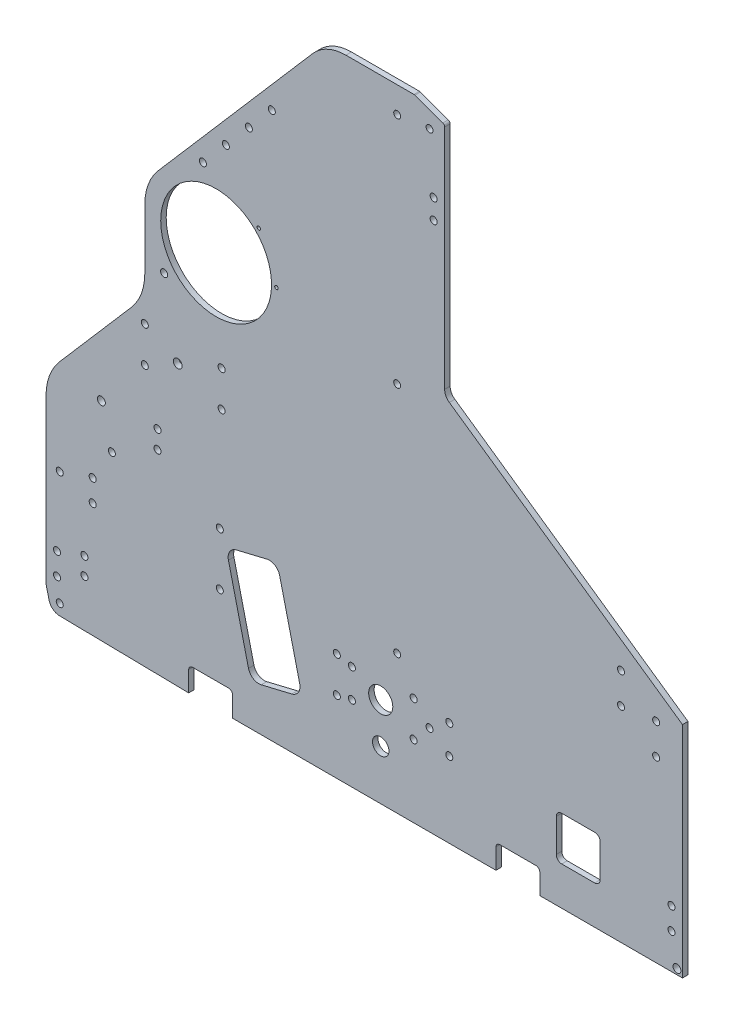
from build123d import *

# Parameters (mm, degrees)
SKETCH1_R           = 2.032
SKETCH1_R_2         = 2.54
SKETCH1_R_3         = 2
BOSS_EXTRUDE1_DEPTH = 3.175
FILLET1_R           = 2.286
FILLET2_R           = 6.35
SKETCH2_R           = 2.032
CUT_EXTRUDE1_DEPTH  = 505.524983177
FILLET3_R           = 1.5875
SKETCH3_R           = 2.032
SKETCH3_R_2         = 2.286
SKETCH3_R_3         = 1.016
CUT_EXTRUDE2_DEPTH  = 505.524983177
SKETCH4_R           = 2.032
SKETCH4_R_2         = 6.985
SKETCH4_R_3         = 4.7625
CUT_EXTRUDE3_DEPTH  = 505.524983177
SKETCH5_R           = 32.0675
SKETCH5_R_2         = 2.286
CUT_EXTRUDE5_DEPTH  = 540.282512218
FILLET4_R           = 31.75
CUT_EXTRUDE6_DEPTH  = 505.524983177
SKETCH7_R           = 2.031999999
SKETCH7_R_2         = 2.032
CUT_EXTRUDE7_DEPTH  = 2.54
FILLET5_R           = 25.4


with BuildPart() as part:
    # Sketch1 → Boss-Extrude1 (new body)
    with BuildSketch(Plane.XY):
        with BuildLine():
            Line((7.829508682, -19.049081656), (82.55, -20.32))
            Line((82.55, -20.32), (82.55, -6.35))
            Line((82.55, -6.35), (107.95, -6.35))
            Line((107.95, -6.35), (107.95, -20.32))
            Line((107.95, -20.32), (260.35, -20.32))
            Line((260.35, -20.32), (260.35, -6.35))
            Line((260.35, -6.35), (285.75, -6.35))
            Line((285.75, -6.35), (285.75, -20.32))
            Line((285.75, -20.32), (368.3, -20.32))
            Line((368.3, -20.32), (368.3, 106.68))
            Line((368.3, 106.68), (230.66375, 202.565))
            Line((230.66375, 202.565), (230.66375, 338.455))
            Line((230.66375, 338.455), (213.19998, 344.805))
            Line((213.19998, 344.805), (203.2, 344.805))
            Line((203.2, 344.805), (161.925, 344.805))
            Line((161.925, 344.805), (52.720122664, 218.469945827))
            ThreePointArc((52.720122664, 218.469945827), (52.803835479, 218.142145922), (52.832, 217.805))
            ThreePointArc((52.832, 217.805), (52.095493096, 216.239521914), (50.419872403, 215.808871996))
            Line((50.419872403, 215.808871996), (0, 157.48))
            Line((0, 157.48), (0, 0))
            Line((0, 0), (0, -6.35))
            ThreePointArc((0, -6.35), (0.047577015, -7.125863724), (0.189595124, -7.890101219))
            Line((0.189595124, -7.890101219), (1.777095124, -14.240101219))
            ThreePointArc((1.777095124, -14.240101219), (3.987212552, -17.671692778), (7.829508682, -19.049081656))
        make_face()
        with Locations((7.9375, -12.7)):
            Circle(SKETCH1_R, mode=Mode.SUBTRACT)
        with Locations((6.35, 0)):
            Circle(SKETCH1_R, mode=Mode.SUBTRACT)
        with Locations((6.35, 12.7)):
            Circle(SKETCH1_R, mode=Mode.SUBTRACT)
        with Locations((38.1, 78.105)):
            Circle(SKETCH1_R, mode=Mode.SUBTRACT)
        with Locations((57.15, 131.28625)):
            Circle(SKETCH1_R, mode=Mode.SUBTRACT)
        with Locations((57.15, 151.92375)):
            Circle(SKETCH1_R, mode=Mode.SUBTRACT)
        with Locations((76.2, 141.605)):
            Circle(SKETCH1_R_2, mode=Mode.SUBTRACT)
        with Locations((101.6, 131.28625)):
            Circle(SKETCH1_R, mode=Mode.SUBTRACT)
        with Locations((101.6, 151.92375)):
            Circle(SKETCH1_R, mode=Mode.SUBTRACT)
        with Locations((203.2, 59.805)):
            Circle(SKETCH1_R_3, mode=Mode.SUBTRACT)
        with Locations((361.95, 0)):
            Circle(SKETCH1_R, mode=Mode.SUBTRACT)
        with Locations((361.95, 12.7)):
            Circle(SKETCH1_R, mode=Mode.SUBTRACT)
        with Locations((353.06, 82.955052336)):
            Circle(SKETCH1_R, mode=Mode.SUBTRACT)
        with Locations((332.74, 98.195052336)):
            Circle(SKETCH1_R, mode=Mode.SUBTRACT)
        with Locations((332.74, 115.975052336)):
            Circle(SKETCH1_R, mode=Mode.SUBTRACT)
        with Locations((353.06, 100.735052336)):
            Circle(SKETCH1_R, mode=Mode.SUBTRACT)
        with Locations((68.326, 182.923674932)):
            Circle(SKETCH1_R, mode=Mode.SUBTRACT)
        with Locations((76.2, 217.805)):
            Circle(SKETCH1_R, mode=Mode.SUBTRACT)
        with Locations((90.779500502, 249.682)):
            Circle(SKETCH1_R, mode=Mode.SUBTRACT)
        with Locations((104.067838673, 265.054783374)):
            Circle(SKETCH1_R, mode=Mode.SUBTRACT)
        with Locations((117.356176844, 280.427566748)):
            Circle(SKETCH1_R, mode=Mode.SUBTRACT)
        with Locations((130.644515014, 295.800350122)):
            Circle(SKETCH1_R, mode=Mode.SUBTRACT)
        with Locations((203.2, 194.805)):
            Circle(SKETCH1_R_3, mode=Mode.SUBTRACT)
        with Locations((224.31375, 287.401)):
            Circle(SKETCH1_R, mode=Mode.SUBTRACT)
        with Locations((224.31375, 298.831)):
            Circle(SKETCH1_R, mode=Mode.SUBTRACT)
        with Locations((203.2, 329.805)):
            Circle(SKETCH1_R_3, mode=Mode.SUBTRACT)
        with Locations((221.931865, 332.105)):
            Circle(SKETCH1_R_3, mode=Mode.SUBTRACT)
    extrude(amount=BOSS_EXTRUDE1_DEPTH)

    # Fillet1
    fillet1_edges = [part.edges().sort_by_distance(p)[0] for p in [
        (285.75, -6.35, 1.5875),
        (107.95, -6.35, 1.5875),
        (260.35, -6.35, 1.5875),
        (82.55, -6.35, 1.5875),
    ]]
    fillet(fillet1_edges, radius=FILLET1_R)

    # Fillet2
    fillet2_edges = [part.edges().sort_by_distance(p)[0] for p in [
        (230.66375, 202.565, 1.5875),
    ]]
    fillet(fillet2_edges, radius=FILLET2_R)

    # Sketch2 → Cut-Extrude1 (cut, through all)
    with BuildSketch(Plane(origin=(0, 0, 0), x_dir=(-1, 0, 0), z_dir=(0, 0, -1))):
        with Locations((-100.552770272, 71.086035298)):
            Circle(SKETCH2_R)
        with Locations((-100.552770272, 40.606035298)):
            Circle(SKETCH2_R)
        with Locations((-22.225, 18.202541089)):
            Circle(SKETCH2_R)
        with Locations((-22.225, 8.042541089)):
            Circle(SKETCH2_R)
    extrude(amount=-CUT_EXTRUDE1_DEPTH, mode=Mode.SUBTRACT)

    # Fillet3
    fillet3_edges = [part.edges().sort_by_distance(p)[0] for p in [
        (230.66375, 338.455, 1.5875),
        (213.19998, 344.805, 1.5875),
    ]]
    fillet(fillet3_edges, radius=FILLET3_R)

    # Sketch3 → Cut-Extrude2 (cut, through all)
    with BuildSketch(Plane.XY.offset(3.175)):
        with BuildLine():
            Line((127.789350211, 69.359774106), (110.090750339, 65.117184968))
            ThreePointArc((110.090750339, 65.117184968), (106.287939856, 62.356288953), (105.55119507, 57.715047577))
            Line((105.55119507, 57.715047577), (117.160037875, 9.287010566))
            ThreePointArc((117.160037875, 9.287010566), (119.92093389, 5.484200083), (124.562175266, 4.747455297))
            Line((124.562175266, 4.747455297), (142.260775137, 8.990044434))
            ThreePointArc((142.260775137, 8.990044434), (146.063585621, 11.75094045), (146.800330407, 16.392181825))
            Line((146.800330407, 16.392181825), (135.191487602, 64.820218836))
            ThreePointArc((135.191487602, 64.820218836), (132.430591586, 68.62302932), (127.789350211, 69.359774106))
        make_face()
        with Locations((26.987500002, 46.953113935)):
            Circle(SKETCH3_R)
        with Locations((26.987500002, 59.653113935)):
            Circle(SKETCH3_R)
        with Locations((7.937500002, 53.303113935)):
            Circle(SKETCH3_R)
        with Locations((32.030600738, 100.810868776)):
            Circle(SKETCH3_R_2)
        with Locations((64.525942114, 102.94048958)):
            Circle(SKETCH3_R)
        with Locations((64.525942114, 92.525786339)):
            Circle(SKETCH3_R)
        with Locations((133.35, 208.228121768)):
            Circle(SKETCH3_R_3)
        with Locations((123.120704333, 232.923826101)):
            Circle(SKETCH3_R_3)
    extrude(amount=-CUT_EXTRUDE2_DEPTH, mode=Mode.SUBTRACT)

    # Sketch4 → Cut-Extrude3 (cut, through all)
    with BuildSketch(Plane.XY.offset(3.175)):
        with Locations((168.275, 42.06875)):
            Circle(SKETCH4_R)
        with Locations((212.725, 42.06875)):
            Circle(SKETCH4_R)
        with Locations((212.725, 21.43125)):
            Circle(SKETCH4_R)
        with Locations((168.275, 21.43125)):
            Circle(SKETCH4_R)
        with Locations((193.675, 31.75)):
            Circle(SKETCH4_R_2)
        with Locations((177.00498, 40.0431)):
            Circle(SKETCH4_R)
        with Locations((177.00498, 23.4569)):
            Circle(SKETCH4_R)
        with Locations((193.675, 8.466666658)):
            Circle(SKETCH4_R_3)
        with Locations((221.931865, 31.75)):
            Circle(SKETCH4_R)
        with Locations((233.36123, 23.4569)):
            Circle(SKETCH4_R)
        with Locations((233.36123, 40.0431)):
            Circle(SKETCH4_R)
    extrude(amount=-CUT_EXTRUDE3_DEPTH, mode=Mode.SUBTRACT)

    # Sketch5 → Cut-Extrude5 (cut, through all)
    with BuildSketch(Plane(origin=(0, 0, -187.324999893), x_dir=(-1, 0, 0), z_dir=(0, 0, -1))):
        Polygon((0, 157.48), (-57.15, 223.594705882), (-57.15, 165.333696112), (0, 99.218990229), align=None)
        with Locations((-98.425, 208.228121768)):
            Circle(SKETCH5_R)
        with Locations((-365.124993903, -17.144956474)):
            Circle(SKETCH5_R_2)
    extrude(amount=-CUT_EXTRUDE5_DEPTH, mode=Mode.SUBTRACT)

    # Fillet4
    fillet4_edges = [part.edges().sort_by_distance(p)[0] for p in [
        (0, 99.218990229, 1.5875),
        (57.15, 165.333696112, 1.5875),
        (57.15, 223.594705882, 1.5875),
    ]]
    fillet(fillet4_edges, radius=FILLET4_R)

    # Sketch6 → Cut-Extrude6 (cut, through all)
    with BuildSketch(Plane.XY.offset(3.175)):
        with BuildLine():
            Line((298.45, 27.305), (317.5, 27.305))
            ThreePointArc((317.5, 27.305), (319.74506403, 26.37506403), (320.675, 24.13))
            Line((320.675, 24.13), (320.675, 5.08))
            ThreePointArc((320.675, 5.08), (319.74506403, 2.83493597), (317.5, 1.905))
            Line((317.5, 1.905), (298.45, 1.905))
            ThreePointArc((298.45, 1.905), (296.20493597, 2.83493597), (295.275, 5.08))
            Line((295.275, 5.08), (295.275, 24.13))
            ThreePointArc((295.275, 24.13), (296.20493597, 26.37506403), (298.45, 27.305))
        make_face()
    extrude(amount=-CUT_EXTRUDE6_DEPTH, mode=Mode.SUBTRACT)

    # Sketch7 → Cut-Extrude7 (cut)
    with BuildSketch(Plane(origin=(0, 0, 0), x_dir=(-1, 0, 0), z_dir=(0, 0, -1))):
        with Locations((-215.9, 306.705000002)):
            Circle(SKETCH7_R)
        with Locations((-203.2, 306.705000002)):
            Circle(SKETCH7_R_2)
        with Locations((-190.5, 306.705000002)):
            Circle(SKETCH7_R_2)
        with Locations((-177.8, 306.705000002)):
            Circle(SKETCH7_R_2)
        with Locations((-215.9, 255.905000002)):
            Circle(SKETCH7_R)
        with Locations((-203.2, 255.905000002)):
            Circle(SKETCH7_R_2)
        with Locations((-190.5, 255.905000002)):
            Circle(SKETCH7_R_2)
        with Locations((-177.8, 255.905000002)):
            Circle(SKETCH7_R_2)
    extrude(amount=-CUT_EXTRUDE7_DEPTH, mode=Mode.SUBTRACT)

    # Fillet5
    fillet5_edges = [part.edges().sort_by_distance(p)[0] for p in [
        (161.925, 344.805, 1.5875),
    ]]
    fillet(fillet5_edges, radius=FILLET5_R)


solid = part.part
